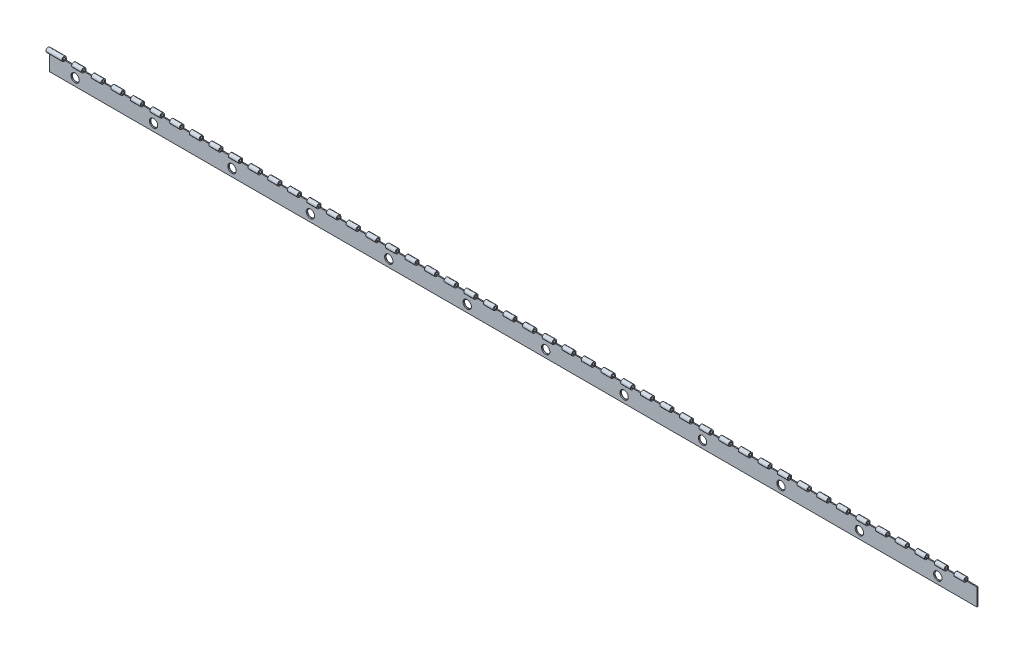
from build123d import *

# Parameters (mm, degrees)
BOSS_EXTRUDE2_DEPTH          = 300.4
SKETCH6_W                    = 6.35
SKETCH6_H                    = 2.8702
CUT_EXTRUDE1_DEPTH           = 301.671763742
LPATTERN1_COUNT              = 47
LPATTERN1_PITCH              = 12.7
CUT_EXTRUDE2_START           = 0.238125
SKETCH8_R                    = 2.3622
CUT_EXTRUDE2_DEPTH           = 0.635
CUT_EXTRUDE2_TAPER           = -41
CUT_EXTRUDE2_OTHER_WAY_DEPTH = 301.68203812


# Read off the part's stored shape, not the designer's step: LPattern2
with BuildPart() as part:
    # Sketch5 → Boss-Extrude2 (new, symmetric)
    with BuildSketch(Plane(origin=(0, 0, 0), x_dir=(0, 0, -1), z_dir=(1, 0, 0))):
        with BuildLine():
            Line((0.606499467, -1.300642305), (0.338136871, -0.72513686))
            ThreePointArc((0.338136871, -0.72513686), (-0.674797496, 0.429893417), (0.8001, 0))
            Line((0.8001, 0), (0.8001, -12.7))
            Line((0.8001, -12.7), (1.4351, -12.7))
            Line((1.4351, -12.7), (1.4351, 0))
            ThreePointArc((1.4351, 0), (-1.210351064, 0.771078668), (0.606499467, -1.300642305))
        make_face()
    extrude(amount=BOSS_EXTRUDE2_DEPTH, both=True)

    # Sketch6 → Cut-Extrude1 (cut, symmetric)
    with BuildSketch(Plane.XY):
        with Locations((297.225, 0)):
            Rectangle(SKETCH6_W, SKETCH6_H)
    cut_extrude1 = extrude(amount=CUT_EXTRUDE1_DEPTH, both=True, mode=Mode.SUBTRACT)

    # LPattern1: Cut-Extrude1 ×47
    with Locations(*[(-i * LPATTERN1_PITCH, 0, 0) for i in range(1, LPATTERN1_COUNT)]):
        add(cut_extrude1, mode=Mode.SUBTRACT)

    # Sketch8 → Cut-Extrude2 (cut)
    with BuildSketch(Plane.XY.offset(-1.4351).offset(CUT_EXTRUDE2_START)):
        with Locations((275, -7.9375)):
            Circle(SKETCH8_R)
    extrude(amount=CUT_EXTRUDE2_DEPTH, taper=CUT_EXTRUDE2_TAPER, mode=Mode.SUBTRACT)

    # Sketch8 → Cut-Extrude2 other way (cut)
    with BuildSketch(Plane.XY.offset(-1.4351).offset(CUT_EXTRUDE2_START)):
        with Locations((275, -7.9375)):
            Circle(SKETCH8_R)
    extrude(amount=-CUT_EXTRUDE2_OTHER_WAY_DEPTH, mode=Mode.SUBTRACT)

    # LPattern2 outline → LPattern2 (revolve, cut)
    with BuildSketch(Plane(origin=(-283.8, -7.9375, 0), x_dir=(1, 0, 0), z_dir=(0, -1, 0))):
        Polygon((0, -1.4351), (2.3622, -1.4351), (2.3622, -1.196975), (2.707198174, -0.8001), (0, -0.8001), align=None)
    revolve(axis=Axis((-283.8, -7.9375, 0), (0, 0, 1)), mode=Mode.SUBTRACT)

    # LPattern2 2 outline → LPattern2 2 (revolve, cut)
    with BuildSketch(Plane(origin=(-233, -7.9375, 0), x_dir=(1, 0, 0), z_dir=(0, -1, 0))):
        Polygon((0, -1.4351), (2.3622, -1.4351), (2.3622, -1.196975), (2.707198174, -0.8001), (0, -0.8001), align=None)
    revolve(axis=Axis((-233, -7.9375, 0), (0, 0, 1)), mode=Mode.SUBTRACT)

    # LPattern2 3 outline → LPattern2 3 (revolve, cut)
    with BuildSketch(Plane(origin=(-182.2, -7.9375, 0), x_dir=(1, 0, 0), z_dir=(0, -1, 0))):
        Polygon((0, -1.4351), (2.3622, -1.4351), (2.3622, -1.196975), (2.707198174, -0.8001), (0, -0.8001), align=None)
    revolve(axis=Axis((-182.2, -7.9375, 0), (0, 0, 1)), mode=Mode.SUBTRACT)

    # LPattern2 4 outline → LPattern2 4 (revolve, cut)
    with BuildSketch(Plane(origin=(-131.4, -7.9375, 0), x_dir=(1, 0, 0), z_dir=(0, -1, 0))):
        Polygon((0, -1.4351), (2.3622, -1.4351), (2.3622, -1.196975), (2.707198174, -0.8001), (0, -0.8001), align=None)
    revolve(axis=Axis((-131.4, -7.9375, 0), (0, 0, 1)), mode=Mode.SUBTRACT)

    # LPattern2 5 outline → LPattern2 5 (revolve, cut)
    with BuildSketch(Plane(origin=(-80.6, -7.9375, 0), x_dir=(1, 0, 0), z_dir=(0, -1, 0))):
        Polygon((0, -1.4351), (2.3622, -1.4351), (2.3622, -1.196975), (2.707198174, -0.8001), (0, -0.8001), align=None)
    revolve(axis=Axis((-80.6, -7.9375, 0), (0, 0, 1)), mode=Mode.SUBTRACT)

    # LPattern2 6 outline → LPattern2 6 (revolve, cut)
    with BuildSketch(Plane(origin=(-29.8, -7.9375, 0), x_dir=(1, 0, 0), z_dir=(0, -1, 0))):
        Polygon((0, -1.4351), (2.3622, -1.4351), (2.3622, -1.196975), (2.707198174, -0.8001), (0, -0.8001), align=None)
    revolve(axis=Axis((-29.8, -7.9375, 0), (0, 0, 1)), mode=Mode.SUBTRACT)

    # LPattern2 7 outline → LPattern2 7 (revolve, cut)
    with BuildSketch(Plane(origin=(21, -7.9375, 0), x_dir=(1, 0, 0), z_dir=(0, -1, 0))):
        Polygon((0, -1.4351), (2.3622, -1.4351), (2.3622, -1.196975), (2.707198174, -0.8001), (0, -0.8001), align=None)
    revolve(axis=Axis((21, -7.9375, 0), (0, 0, 1)), mode=Mode.SUBTRACT)

    # LPattern2 8 outline → LPattern2 8 (revolve, cut)
    with BuildSketch(Plane(origin=(71.8, -7.9375, 0), x_dir=(1, 0, 0), z_dir=(0, -1, 0))):
        Polygon((0, -1.4351), (2.3622, -1.4351), (2.3622, -1.196975), (2.707198174, -0.8001), (0, -0.8001), align=None)
    revolve(axis=Axis((71.8, -7.9375, 0), (0, 0, 1)), mode=Mode.SUBTRACT)

    # LPattern2 9 outline → LPattern2 9 (revolve, cut)
    with BuildSketch(Plane(origin=(122.6, -7.9375, 0), x_dir=(1, 0, 0), z_dir=(0, -1, 0))):
        Polygon((0, -1.4351), (2.3622, -1.4351), (2.3622, -1.196975), (2.707198174, -0.8001), (0, -0.8001), align=None)
    revolve(axis=Axis((122.6, -7.9375, 0), (0, 0, 1)), mode=Mode.SUBTRACT)

    # LPattern2 10 outline → LPattern2 10 (revolve, cut)
    with BuildSketch(Plane(origin=(173.4, -7.9375, 0), x_dir=(1, 0, 0), z_dir=(0, -1, 0))):
        Polygon((0, -1.4351), (2.3622, -1.4351), (2.3622, -1.196975), (2.707198174, -0.8001), (0, -0.8001), align=None)
    revolve(axis=Axis((173.4, -7.9375, 0), (0, 0, 1)), mode=Mode.SUBTRACT)

    # LPattern2 11 outline → LPattern2 11 (revolve, cut)
    with BuildSketch(Plane(origin=(224.2, -7.9375, 0), x_dir=(1, 0, 0), z_dir=(0, -1, 0))):
        Polygon((2.707198174, -0.8001), (0, -0.8001), (0, -1.4351), (2.3622, -1.4351), (2.3622, -1.196975), align=None)
    revolve(axis=Axis((224.2, -7.9375, 0), (0, 0, 1)), mode=Mode.SUBTRACT)


solid = part.part
